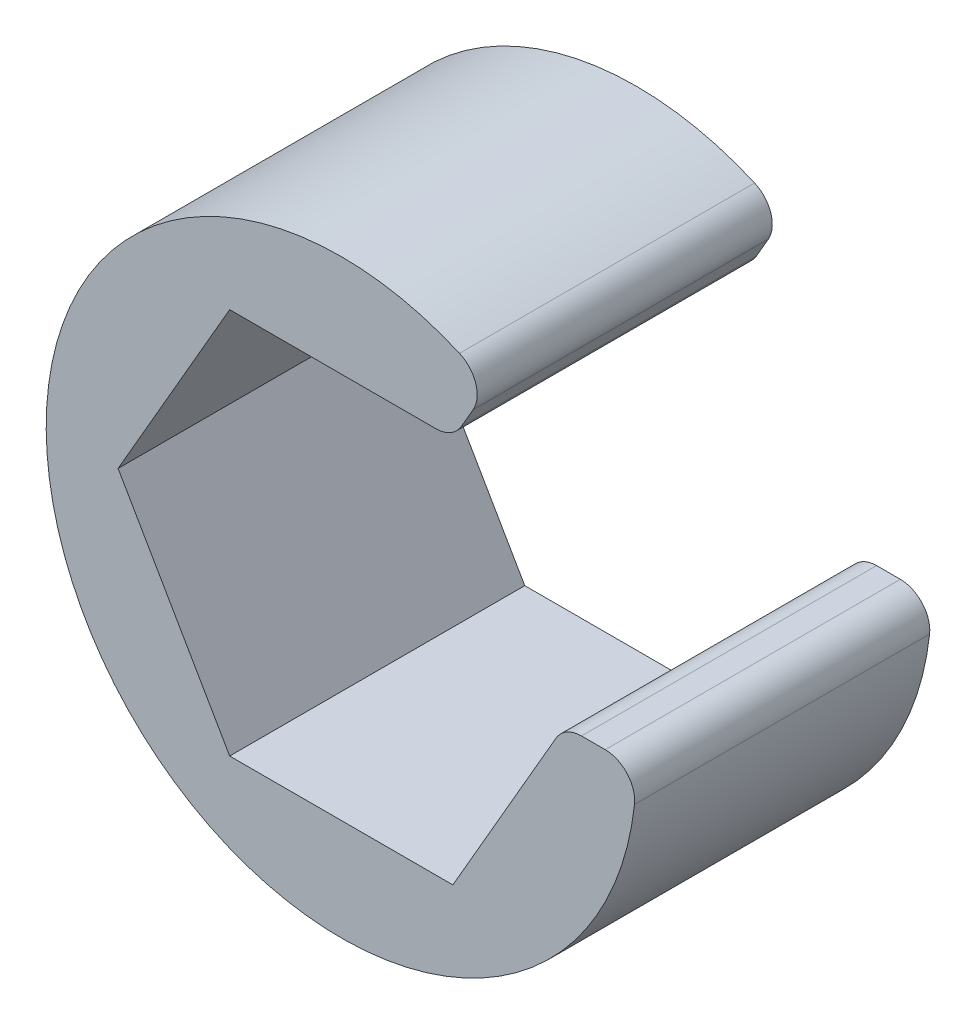
from build123d import *

# Parameters (mm, degrees)
BOSS_EXTRUDE1_DEPTH = 10
FILLET1_R           = 1


with BuildPart() as part:
    # Sketch1 → Boss-Extrude1 (new body)
    with BuildSketch(Plane.XY):
        with BuildLine():
            Line((5, 8.660254038), (3.781644263, 6.55))
            Line((3.781644263, 6.55), (-3.781644263, 6.55))
            Line((-3.781644263, 6.55), (-7.563288526, 0))
            Line((-7.563288526, 0), (-3.781644263, -6.55))
            Line((-3.781644263, -6.55), (3.781644263, -6.55))
            Line((3.781644263, -6.55), (7.563288526, 0))
            Line((7.563288526, 0), (10, 0))
            ThreePointArc((10, 0), (-8.660254038, -5), (5, 8.660254038))
        make_face()
    extrude(amount=BOSS_EXTRUDE1_DEPTH)

    # Fillet1
    fillet1_edges = [part.edges().sort_by_distance(p)[0] for p in [
        (7.563288526, 0, 5),
        (10, 0, 5),
        (3.781644263, 6.55, 5),
        (5, 8.660254038, 5),
    ]]
    fillet(fillet1_edges, radius=FILLET1_R)


solid = part.part
